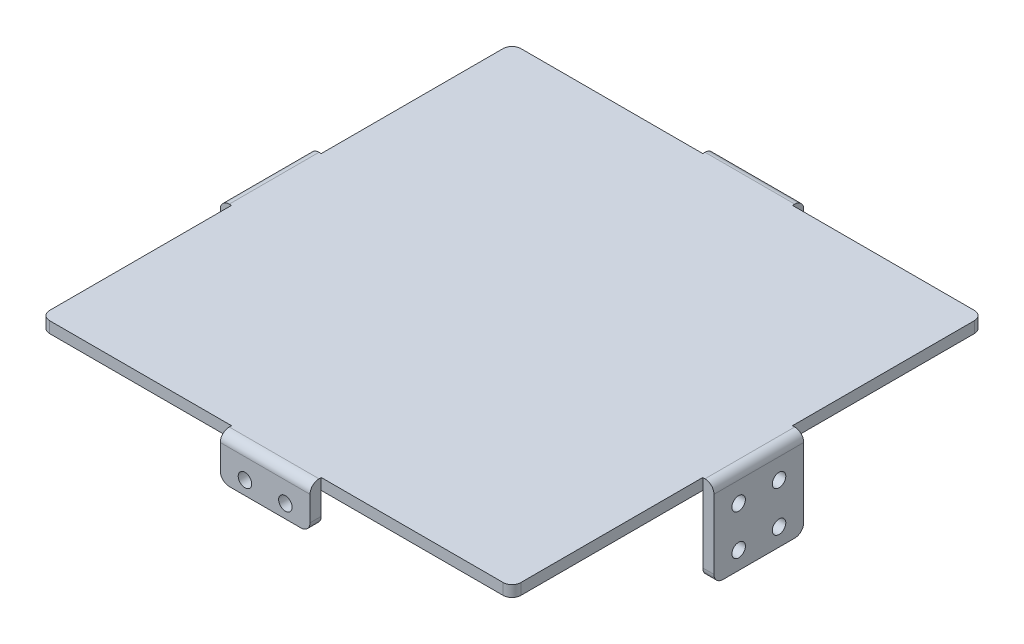
from build123d import *

# Parameters (mm, degrees)
SKETCH1_W           = 105
SKETCH1_H           = 105
BOSS_EXTRUDE1_DEPTH = 2.5
SKETCH2_W           = 20
SKETCH2_H           = 2.5
BOSS_EXTRUDE2_DEPTH = 9.5
SKETCH3_W           = 2.5
SKETCH3_H           = 20
BOSS_EXTRUDE3_DEPTH = 19.45
SKETCH4_R           = 1.5
CUT_EXTRUDE1_DEPTH  = 125.146294749
SKETCH5_R           = 1.5
CUT_EXTRUDE2_DEPTH  = 125.146294749
FILLET1_R           = 2
FILLET2_R           = 2
FILLET3_R           = 2


with BuildPart() as part:
    # Sketch1 → Boss-Extrude1 (new body)
    with BuildSketch(Plane(origin=(0, 0, 0), x_dir=(1, 0, 0), z_dir=(0, 1, 0))):
        Rectangle(SKETCH1_W, SKETCH1_H)
    extrude(amount=BOSS_EXTRUDE1_DEPTH)

    # Sketch2 → Boss-Extrude2 (add)
    with BuildSketch(Plane(origin=(0, 2.5, 0), x_dir=(1, 0, 0), z_dir=(0, 1, 0))):
        with Locations((0, 53.75)):
            Rectangle(SKETCH2_W, SKETCH2_H)
        with Locations((0, -53.75)):
            Rectangle(SKETCH2_W, SKETCH2_H)
    extrude(amount=-BOSS_EXTRUDE2_DEPTH)

    # Sketch3 → Boss-Extrude3 (add)
    with BuildSketch(Plane(origin=(0, 2.5, 0), x_dir=(1, 0, 0), z_dir=(0, 1, 0))):
        with Locations((53.75, 0)):
            Rectangle(SKETCH3_W, SKETCH3_H)
        with Locations((-53.75, 0)):
            Rectangle(SKETCH3_W, SKETCH3_H)
    extrude(amount=-BOSS_EXTRUDE3_DEPTH)

    # Sketch4 → Cut-Extrude1 (cut, through all)
    with BuildSketch(Plane.XY.offset(55)):
        with Locations((-4.5, -4)):
            Circle(SKETCH4_R)
        with Locations((4.5, -4)):
            Circle(SKETCH4_R)
    extrude(amount=-CUT_EXTRUDE1_DEPTH, mode=Mode.SUBTRACT)

    # Sketch5 → Cut-Extrude2 (cut, through all)
    with BuildSketch(Plane(origin=(55, 0, 0), x_dir=(0, 0, -1), z_dir=(1, 0, 0))):
        with Locations((-4.5, -4)):
            Circle(SKETCH5_R)
        with Locations((4.5, -4)):
            Circle(SKETCH5_R)
        with Locations((4.5, -13)):
            Circle(SKETCH5_R)
        with Locations((-4.5, -13)):
            Circle(SKETCH5_R)
    extrude(amount=-CUT_EXTRUDE2_DEPTH, mode=Mode.SUBTRACT)

    # Fillet1
    fillet1_edges = [part.edges().sort_by_distance(p)[0] for p in [
        (-10, -7, -53.75),
        (10, -7, -53.75),
        (10, -7, 53.75),
        (-10, -7, 53.75),
        (53.75, -16.95, 10),
        (53.75, -16.95, -10),
        (-53.75, -16.95, -10),
        (-53.75, -16.95, 10),
    ]]
    fillet(fillet1_edges, radius=FILLET1_R)

    # Fillet2
    fillet2_edges = [part.edges().sort_by_distance(p)[0] for p in [
        (-55, 2.5, 0),
        (55, 2.5, 0),
        (0, 2.5, -55),
        (0, 2.5, 55),
    ]]
    fillet(fillet2_edges, radius=FILLET2_R)

    # Fillet3
    fillet3_edges = [part.edges().sort_by_distance(p)[0] for p in [
        (52.5, 1.25, -52.5),
        (52.5, 1.25, 52.5),
        (-52.5, 1.25, 52.5),
        (-52.5, 1.25, -52.5),
    ]]
    fillet(fillet3_edges, radius=FILLET3_R)


solid = part.part
